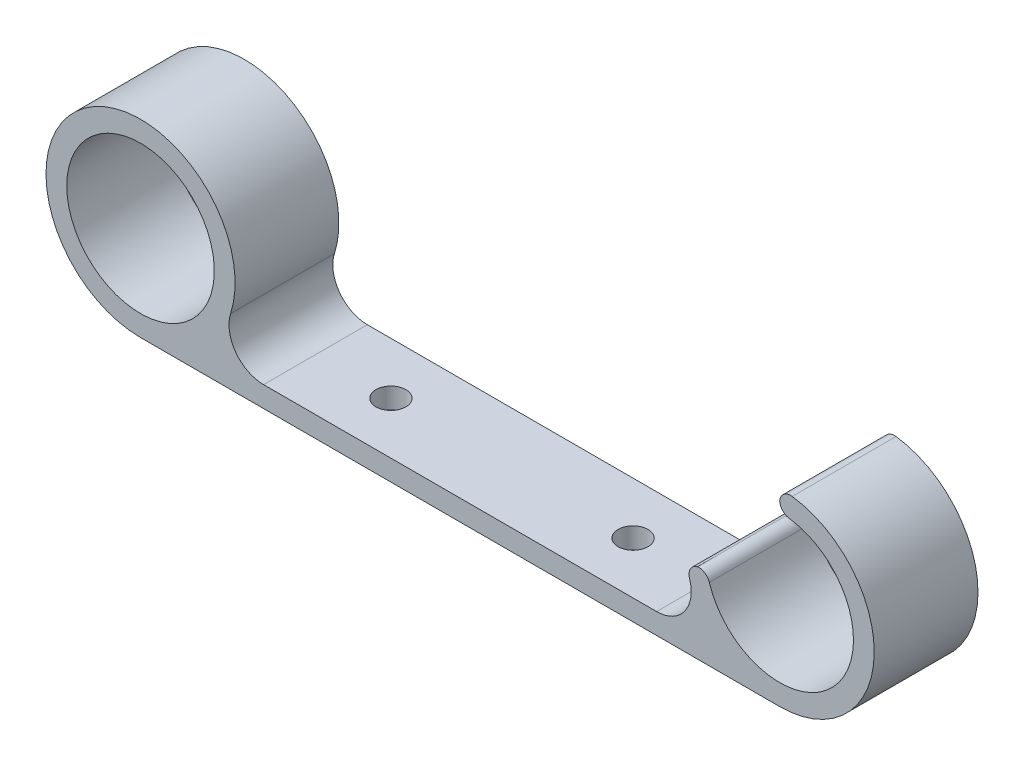
from build123d import *

# Parameters (mm, degrees)
SKETCH3_W           = 114.3
SKETCH3_H           = 19.05
BOSS_EXTRUDE1_DEPTH = 3.81
SKETCH4_R           = 13.5453125
BOSS_EXTRUDE2_DEPTH = 9.525
FILLET1_R           = 2.032
SKETCH5_R           = 2.75
CUT_EXTRUDE4_DEPTH  = 12.7


with BuildPart() as part:
    # Sketch3 → Boss-Extrude1 (new body)
    with BuildSketch(Plane(origin=(0, 0, 0), x_dir=(1, 0, 0), z_dir=(0, 1, 0))):
        Rectangle(SKETCH3_W, SKETCH3_H)
    extrude(amount=BOSS_EXTRUDE1_DEPTH)

    # Sketch4 → Boss-Extrude2 (add, symmetric)
    with BuildSketch(Plane.XY):
        with BuildLine():
            Line((-36.071859255, 3.81), (36.071859255, 3.81))
            ThreePointArc((36.071859255, 3.81), (41.198342199, 6.412778013), (42.122274879, 12.087425946))
            ThreePointArc((42.122274879, 12.087425946), (41.806974837, 13.2052175), (41.567140999, 14.341594112))
            Line((41.567140999, 14.341594112), (45.319258538, 15.003193668))
            ThreePointArc((45.319258538, 15.003193668), (67.365546349, 6.979001129), (63.291557028, 30.083742702))
            ThreePointArc((63.291557028, 30.083742702), (61.010906137, 30.694841267), (58.658787305, 30.900625))
            Line((58.658787305, 30.900625), (58.658787305, 34.710625))
            ThreePointArc((58.658787305, 34.710625), (61.672505693, 34.446958806), (64.594653774, 33.663971588))
            ThreePointArc((64.594653774, 33.663971588), (75.750433611, 14.341594112), (58.658787305, 0))
            Line((58.658787305, 0), (-58.658787305, 0))
            ThreePointArc((-58.658787305, 0), (-70.930846463, 5.083253342), (-76.014099805, 17.3553125))
            ThreePointArc((-76.014099805, 17.3553125), (-55.993216901, 34.504703346), (-42.122274879, 12.087425946))
            ThreePointArc((-42.122274879, 12.087425946), (-41.198342199, 6.412778013), (-36.071859255, 3.81))
        make_face()
        with Locations(Location((-58.658787305, 17.3553125, 0), (0, 0, 180))):
            Circle(SKETCH4_R, mode=Mode.SUBTRACT)
    extrude(amount=BOSS_EXTRUDE2_DEPTH, both=True)

    # Fillet1
    # the kernel refuses this fillet: 2.032 mm, written as the material it takes off along each edge
    with BuildSketch(Plane(origin=(58.658787305, 34.710625, 0), x_dir=(0, -1, 0), z_dir=(0, 0, -1)), Plane(origin=(41.567140999, 14.341594112, 0), x_dir=(0.9848077530122078, 0.17364817766693208, 0), z_dir=(0, 0, 1))) as fillet1_piece_1:
        with BuildLine():
            CenterArc((2.16732771, -2.032), FILLET1_R, 90, 97.620348072)
            ThreePointArc((0.153273302, -2.301460275), (0.03836072, -1.153279249), (0, 0))
            Line((0, 0), (2.16732771, 0))
        make_face()
    extrude(amount=15.291396244, mode=Mode.SUBTRACT)
    with BuildSketch(Plane(origin=(58.658787305, 30.900625, 0), x_dir=(0.9978615634411592, -0.06536283505758803, 0), z_dir=(0, 0, -1)), Plane(origin=(45.319258538, 15.003193668, 0), x_dir=(0.23764666877900192, -0.9713516669148425, 0), z_dir=(0, 0, 1))) as fillet1_piece_2:
        with BuildLine():
            CenterArc((1.903537334, -2.027654697), FILLET1_R, 93.747686363, 82.504627273)
            Line((-0.124117363, -1.894837416), (0, 0))
            ThreePointArc((0, 0), (0.885360027, -0.028965791), (1.770720053, 0))
        make_face()
    extrude(amount=14.272245223, mode=Mode.SUBTRACT)
    with BuildSketch(Plane(origin=(45.319258538, 15.003193668, 0), x_dir=(-0.9848077530122076, -0.17364817766693288, 0), z_dir=(0, 0, -1)), Plane(origin=(58.658787305, 30.900625, 0), x_dir=(0, 1, 0), z_dir=(0, 0, 1))) as fillet1_piece_3:
        with BuildLine():
            CenterArc((1.898898089, -2.032), FILLET1_R, 90, 82.504627273)
            ThreePointArc((-0.115739283, -1.766933481), (-0.028965791, -0.885360027), (0, 0))
            Line((0, 0), (1.898898089, 0))
        make_face()
    extrude(amount=14.272245223, mode=Mode.SUBTRACT)
    with BuildSketch(Plane(origin=(41.567140999, 14.341594112, 0), x_dir=(0.23870589854739682, -0.9710919081110089, 0), z_dir=(0, 0, -1)), Plane(origin=(58.658787305, 34.710625, 0), x_dir=(0.9977896842762429, -0.06645107938864023, 0), z_dir=(0, 0, 1))) as fillet1_piece_4:
        with BuildLine():
            CenterArc((2.171529904, -2.027508638), FILLET1_R, 86.189825964, 97.620348072)
            Line((0.144021266, -2.162537232), (0, 0))
            ThreePointArc((0, 0), (1.153279249, 0.03836072), (2.306558498, 0))
        make_face()
    extrude(amount=15.291396244, mode=Mode.SUBTRACT)

    # Sketch5 → Cut-Extrude4 (cut)
    with BuildSketch(Plane(origin=(0, 3.81, 0), x_dir=(1, 0, 0), z_dir=(0, 1, 0))):
        with Locations(Location((-22.225, 0, 0), (0, 0, 270))):
            Circle(SKETCH5_R)
        with Locations(Location((22.225, 0, 0), (0, 0, 270))):
            Circle(SKETCH5_R)
    extrude(amount=-CUT_EXTRUDE4_DEPTH, mode=Mode.SUBTRACT)


solid = part.part
